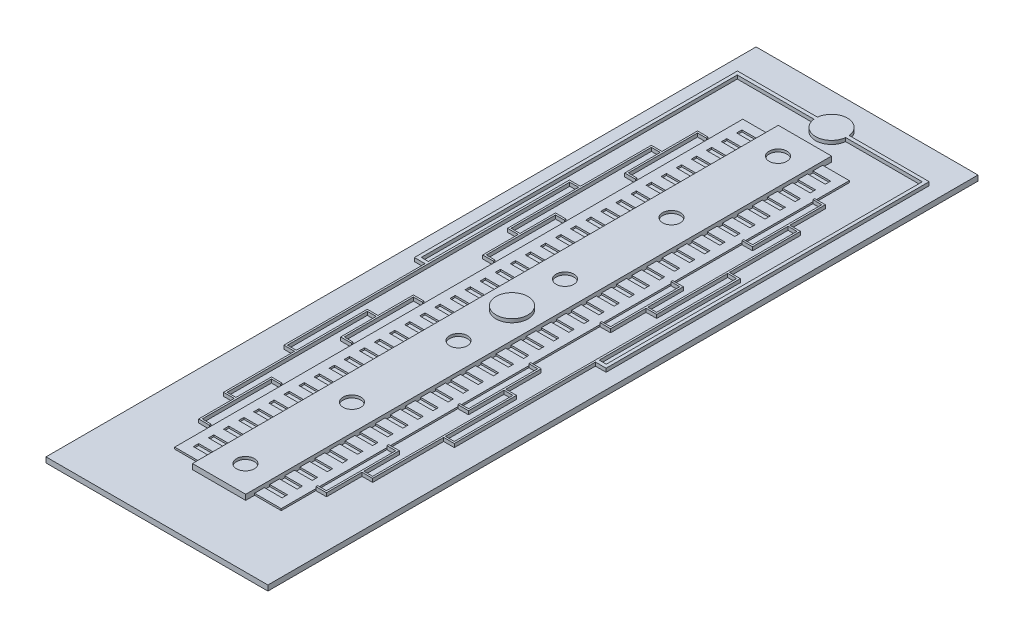
from build123d import *

# Parameters (mm, degrees)
SKETCH2_W           = 12.5
SKETCH2_H           = 40
BOSS_EXTRUDE1_DEPTH = 0.3
SKETCH3_W           = 3
SKETCH3_H           = 33
BOSS_EXTRUDE2_DEPTH = 0.3
SKETCH4_W           = 1.5
SKETCH4_H           = 32
BOSS_EXTRUDE3_DEPTH = 0.1
SKETCH5_W           = 1
SKETCH5_H           = 0.3
CUT_EXTRUDE1_DEPTH  = 0.1
BOSS_EXTRUDE4_DEPTH = 0.2
SKETCH7_R           = 0.9
BOSS_EXTRUDE5_DEPTH = 0.2
SKETCH8_R           = 0.5
CUT_EXTRUDE2_DEPTH  = 0.15


with BuildPart() as part:
    # Sketch2 → Boss-Extrude1 (new body)
    with BuildSketch(Plane(origin=(0, 0, 0), x_dir=(1, 0, 0), z_dir=(0, 1, 0))):
        Rectangle(SKETCH2_W, SKETCH2_H)
    extrude(amount=BOSS_EXTRUDE1_DEPTH)

    # Sketch3 → Boss-Extrude2 (add)
    with BuildSketch(Plane(origin=(0, 0.3, 0), x_dir=(1, 0, 0), z_dir=(0, 1, 0))):
        Rectangle(SKETCH3_W, SKETCH3_H)
    extrude(amount=BOSS_EXTRUDE2_DEPTH)

    # Sketch4 → Boss-Extrude3 (add)
    with BuildSketch(Plane(origin=(0, 0.3, 0), x_dir=(1, 0, 0), z_dir=(0, 1, 0))):
        with Locations((2.25, 0)):
            Rectangle(SKETCH4_W, SKETCH4_H)
        with Locations((-2.25, 0)):
            Rectangle(SKETCH4_W, SKETCH4_H)
    extrude(amount=BOSS_EXTRUDE3_DEPTH)

    # Sketch5 → Cut-Extrude1 (cut)
    with BuildSketch(Plane(origin=(0, 0.4, 0), x_dir=(1, 0, 0), z_dir=(0, 1, 0))):
        with Locations((2, 15.3)):
            Rectangle(SKETCH5_W, SKETCH5_H)
        with Locations((-2, 15.3)):
            Rectangle(SKETCH5_W, SKETCH5_H)
        with Locations((-2, 14.45)):
            Rectangle(SKETCH5_W, SKETCH5_H)
        with Locations((-2, 13.6)):
            Rectangle(SKETCH5_W, SKETCH5_H)
        with Locations((-2, 12.75)):
            Rectangle(SKETCH5_W, SKETCH5_H)
        with Locations((-2, 11.9)):
            Rectangle(SKETCH5_W, SKETCH5_H)
        with Locations((-2, 11.05)):
            Rectangle(SKETCH5_W, SKETCH5_H)
        with Locations((-2, 10.2)):
            Rectangle(SKETCH5_W, SKETCH5_H)
        with Locations((-2, 9.35)):
            Rectangle(SKETCH5_W, SKETCH5_H)
        with Locations((-2, 8.5)):
            Rectangle(SKETCH5_W, SKETCH5_H)
        with Locations((-2, 7.65)):
            Rectangle(SKETCH5_W, SKETCH5_H)
        with Locations((-2, 6.8)):
            Rectangle(SKETCH5_W, SKETCH5_H)
        with Locations((-2, 5.95)):
            Rectangle(SKETCH5_W, SKETCH5_H)
        with Locations((-2, 5.1)):
            Rectangle(SKETCH5_W, SKETCH5_H)
        with Locations((-2, 4.25)):
            Rectangle(SKETCH5_W, SKETCH5_H)
        with Locations((-2, 3.4)):
            Rectangle(SKETCH5_W, SKETCH5_H)
        with Locations((-2, 2.55)):
            Rectangle(SKETCH5_W, SKETCH5_H)
        with Locations((-2, 1.7)):
            Rectangle(SKETCH5_W, SKETCH5_H)
        with Locations((-2, 0.85)):
            Rectangle(SKETCH5_W, SKETCH5_H)
        with Locations((-2, 0)):
            Rectangle(SKETCH5_W, SKETCH5_H)
        with Locations((-2, -0.85)):
            Rectangle(SKETCH5_W, SKETCH5_H)
        with Locations((-2, -1.7)):
            Rectangle(SKETCH5_W, SKETCH5_H)
        with Locations((-2, -2.55)):
            Rectangle(SKETCH5_W, SKETCH5_H)
        with Locations((-2, -3.4)):
            Rectangle(SKETCH5_W, SKETCH5_H)
        with Locations((-2, -4.25)):
            Rectangle(SKETCH5_W, SKETCH5_H)
        with Locations((-2, -5.1)):
            Rectangle(SKETCH5_W, SKETCH5_H)
        with Locations((-2, -5.95)):
            Rectangle(SKETCH5_W, SKETCH5_H)
        with Locations((-2, -6.8)):
            Rectangle(SKETCH5_W, SKETCH5_H)
        with Locations((-2, -7.65)):
            Rectangle(SKETCH5_W, SKETCH5_H)
        with Locations((-2, -8.5)):
            Rectangle(SKETCH5_W, SKETCH5_H)
        with Locations((-2, -9.35)):
            Rectangle(SKETCH5_W, SKETCH5_H)
        with Locations((-2, -10.2)):
            Rectangle(SKETCH5_W, SKETCH5_H)
        with Locations((-2, -11.05)):
            Rectangle(SKETCH5_W, SKETCH5_H)
        with Locations((-2, -11.9)):
            Rectangle(SKETCH5_W, SKETCH5_H)
        with Locations((-2, -12.75)):
            Rectangle(SKETCH5_W, SKETCH5_H)
        with Locations((-2, -13.6)):
            Rectangle(SKETCH5_W, SKETCH5_H)
        with Locations((-2, -14.45)):
            Rectangle(SKETCH5_W, SKETCH5_H)
        with Locations((-2, -15.3)):
            Rectangle(SKETCH5_W, SKETCH5_H)
        with Locations((2, 14.45)):
            Rectangle(SKETCH5_W, SKETCH5_H)
        with Locations((2, 13.6)):
            Rectangle(SKETCH5_W, SKETCH5_H)
        with Locations((2, 12.75)):
            Rectangle(SKETCH5_W, SKETCH5_H)
        with Locations((2, 11.9)):
            Rectangle(SKETCH5_W, SKETCH5_H)
        with Locations((2, 11.05)):
            Rectangle(SKETCH5_W, SKETCH5_H)
        with Locations((2, 10.2)):
            Rectangle(SKETCH5_W, SKETCH5_H)
        with Locations((2, 9.35)):
            Rectangle(SKETCH5_W, SKETCH5_H)
        with Locations((2, 8.5)):
            Rectangle(SKETCH5_W, SKETCH5_H)
        with Locations((2, 7.65)):
            Rectangle(SKETCH5_W, SKETCH5_H)
        with Locations((2, 6.8)):
            Rectangle(SKETCH5_W, SKETCH5_H)
        with Locations((2, 5.95)):
            Rectangle(SKETCH5_W, SKETCH5_H)
        with Locations((2, 5.1)):
            Rectangle(SKETCH5_W, SKETCH5_H)
        with Locations((2, 4.25)):
            Rectangle(SKETCH5_W, SKETCH5_H)
        with Locations((2, 3.4)):
            Rectangle(SKETCH5_W, SKETCH5_H)
        with Locations((2, 2.55)):
            Rectangle(SKETCH5_W, SKETCH5_H)
        with Locations((2, 1.7)):
            Rectangle(SKETCH5_W, SKETCH5_H)
        with Locations((2, 0.85)):
            Rectangle(SKETCH5_W, SKETCH5_H)
        with Locations((2, 0)):
            Rectangle(SKETCH5_W, SKETCH5_H)
        with Locations((2, -0.85)):
            Rectangle(SKETCH5_W, SKETCH5_H)
        with Locations((2, -1.7)):
            Rectangle(SKETCH5_W, SKETCH5_H)
        with Locations((2, -2.55)):
            Rectangle(SKETCH5_W, SKETCH5_H)
        with Locations((2, -3.4)):
            Rectangle(SKETCH5_W, SKETCH5_H)
        with Locations((2, -4.25)):
            Rectangle(SKETCH5_W, SKETCH5_H)
        with Locations((2, -5.1)):
            Rectangle(SKETCH5_W, SKETCH5_H)
        with Locations((2, -5.95)):
            Rectangle(SKETCH5_W, SKETCH5_H)
        with Locations((2, -6.8)):
            Rectangle(SKETCH5_W, SKETCH5_H)
        with Locations((2, -7.65)):
            Rectangle(SKETCH5_W, SKETCH5_H)
        with Locations((2, -8.5)):
            Rectangle(SKETCH5_W, SKETCH5_H)
        with Locations((2, -9.35)):
            Rectangle(SKETCH5_W, SKETCH5_H)
        with Locations((2, -10.2)):
            Rectangle(SKETCH5_W, SKETCH5_H)
        with Locations((2, -11.05)):
            Rectangle(SKETCH5_W, SKETCH5_H)
        with Locations((2, -11.9)):
            Rectangle(SKETCH5_W, SKETCH5_H)
        with Locations((2, -12.75)):
            Rectangle(SKETCH5_W, SKETCH5_H)
        with Locations((2, -13.6)):
            Rectangle(SKETCH5_W, SKETCH5_H)
        with Locations((2, -14.45)):
            Rectangle(SKETCH5_W, SKETCH5_H)
        with Locations((2, -15.3)):
            Rectangle(SKETCH5_W, SKETCH5_H)
    extrude(amount=-CUT_EXTRUDE1_DEPTH, mode=Mode.SUBTRACT)

    # Sketch6 → Boss-Extrude4 (add)
    with BuildSketch(Plane(origin=(0, 0.3, 0), x_dir=(1, 0, 0), z_dir=(0, 1, 0))):
        with BuildLine():
            Line((-0.894427191, 18.1), (-5.4, 18.1))
            Line((-5.4, 18.1), (-5.4, -0.1))
            Line((-5.4, -0.1), (-4.8, -0.1))
            Line((-4.8, -0.1), (-4.799975197, -8.05))
            Line((-4.799975197, -8.05), (-4.199975197, -8.05))
            Line((-4.199975197, -8.05), (-4.2, -12.05))
            Line((-4.2, -12.05), (-3.6, -12.05))
            Line((-3.6, -12.05), (-3.6, -14.05))
            Line((-3.6, -14.05), (-3, -14.05))
            Line((-3, -14.05), (-3, -13.95))
            Line((-3, -13.95), (-3.5, -13.95))
            Line((-3.5, -13.95), (-3.5, -10.05))
            Line((-3.5, -10.05), (-3, -10.05))
            Line((-3, -10.05), (-3, -9.95))
            Line((-3, -9.95), (-3.6, -9.95))
            Line((-3.6, -9.95), (-3.6, -11.95))
            Line((-3.6, -11.95), (-4.1, -11.95))
            Line((-4.1, -11.95), (-4.099975197, -4.05))
            Line((-4.099975197, -4.05), (-3.599975197, -4.05))
            Line((-3.599975197, -4.05), (-3.6, -6.05))
            Line((-3.6, -6.05), (-3, -6.05))
            Line((-3, -6.05), (-3, -5.95))
            Line((-3, -5.95), (-3.5, -5.95))
            Line((-3.5, -5.95), (-3.499979331, -2.0545463))
            Line((-3.499979331, -2.0545463), (-3, -2.05))
            Line((-3, -2.05), (-3, -1.95))
            Line((-3, -1.95), (-3.599975197, -1.95545556))
            Line((-3.599975197, -1.95545556), (-3.599975197, -3.95))
            Line((-3.599975197, -3.95), (-4.199975197, -3.95))
            Line((-4.199975197, -3.95), (-4.199975197, -7.95))
            Line((-4.199975197, -7.95), (-4.699975197, -7.95))
            Line((-4.699975197, -7.95), (-4.7, 7.95))
            Line((-4.7, 7.95), (-4.2, 7.95))
            Line((-4.2, 7.95), (-4.2, 3.95))
            Line((-4.2, 3.95), (-3.6, 3.95))
            Line((-3.6, 3.95), (-3.6, 1.95))
            Line((-3.6, 1.95), (-3, 1.95))
            Line((-3, 1.95), (-3, 2.05))
            Line((-3, 2.05), (-3.5, 2.05))
            Line((-3.5, 2.05), (-3.5, 5.95))
            Line((-3.5, 5.95), (-3, 5.95))
            Line((-3, 5.95), (-3, 6.05))
            Line((-3, 6.05), (-3.6, 6.05))
            Line((-3.6, 6.05), (-3.6, 4.05))
            Line((-3.6, 4.05), (-4.1, 4.05))
            Line((-4.1, 4.05), (-4.1, 11.95))
            Line((-4.1, 11.95), (-3.6, 11.95))
            Line((-3.6, 11.95), (-3.6, 9.95))
            Line((-3.6, 9.95), (-3, 9.95))
            Line((-3, 9.95), (-3, 10.05))
            Line((-3, 10.05), (-3.5, 10.05))
            Line((-3.5, 10.05), (-3.5, 13.95))
            Line((-3.5, 13.95), (-3, 13.95))
            Line((-3, 13.95), (-3, 14.05))
            Line((-3, 14.05), (-3.6, 14.05))
            Line((-3.6, 14.05), (-3.6, 12.05))
            Line((-3.6, 12.05), (-4.2, 12.05))
            Line((-4.2, 12.05), (-4.2, 8.05))
            Line((-4.2, 8.05), (-4.811155033, 8.05))
            Line((-4.811155033, 8.05), (-4.811155033, 0.1))
            Line((-4.811155033, 0.1), (-5.211155033, 0.1))
            Line((-5.211155033, 0.1), (-5.211155033, 17.9))
            Line((-5.211155033, 17.9), (-0.894427191, 17.9))
            ThreePointArc((-0.894427191, 17.9), (0, 17.1), (0.894427191, 17.9))
            Line((0.894427191, 17.9), (5.211155033, 17.9))
            Line((5.211155033, 17.9), (5.211155033, 0.1))
            Line((5.211155033, 0.1), (4.811155033, 0.1))
            Line((4.811155033, 0.1), (4.811155033, 8.05))
            Line((4.811155033, 8.05), (4.2, 8.05))
            Line((4.2, 8.05), (4.2, 12.05))
            Line((4.2, 12.05), (3.6, 12.05))
            Line((3.6, 12.05), (3.6, 14.05))
            Line((3.6, 14.05), (3, 14.05))
            Line((3, 14.05), (3, 13.95))
            Line((3, 13.95), (3.5, 13.95))
            Line((3.5, 13.95), (3.5, 10.05))
            Line((3.5, 10.05), (3, 10.05))
            Line((3, 10.05), (3, 9.95))
            Line((3, 9.95), (3.6, 9.95))
            Line((3.6, 9.95), (3.6, 11.95))
            Line((3.6, 11.95), (4.1, 11.95))
            Line((4.1, 11.95), (4.1, 4.05))
            Line((4.1, 4.05), (3.6, 4.05))
            Line((3.6, 4.05), (3.6, 6.05))
            Line((3.6, 6.05), (3, 6.05))
            Line((3, 6.05), (3, 5.95))
            Line((3, 5.95), (3.5, 5.95))
            Line((3.5, 5.95), (3.5, 2.05))
            Line((3.5, 2.05), (3, 2.05))
            Line((3, 2.05), (3, 1.95))
            Line((3, 1.95), (3.6, 1.95))
            Line((3.6, 1.95), (3.6, 3.95))
            Line((3.6, 3.95), (4.2, 3.95))
            Line((4.2, 3.95), (4.2, 7.95))
            Line((4.2, 7.95), (4.7, 7.95))
            Line((4.7, 7.95), (4.699975197, -7.95))
            Line((4.699975197, -7.95), (4.199975197, -7.95))
            Line((4.199975197, -7.95), (4.199975197, -3.95))
            Line((4.199975197, -3.95), (3.599975197, -3.95))
            Line((3.599975197, -3.95), (3.599975197, -1.95545556))
            Line((3.599975197, -1.95545556), (3, -1.95))
            Line((3, -1.95), (3, -2.05))
            Line((3, -2.05), (3.499979331, -2.0545463))
            Line((3.499979331, -2.0545463), (3.5, -5.95))
            Line((3.5, -5.95), (3, -5.95))
            Line((3, -5.95), (3, -6.05))
            Line((3, -6.05), (3.6, -6.05))
            Line((3.6, -6.05), (3.599975197, -4.05))
            Line((3.599975197, -4.05), (4.099975197, -4.05))
            Line((4.099975197, -4.05), (4.1, -11.95))
            Line((4.1, -11.95), (3.6, -11.95))
            Line((3.6, -11.95), (3.6, -9.95))
            Line((3.6, -9.95), (3, -9.95))
            Line((3, -9.95), (3, -10.05))
            Line((3, -10.05), (3.5, -10.05))
            Line((3.5, -10.05), (3.5, -13.95))
            Line((3.5, -13.95), (3, -13.95))
            Line((3, -13.95), (3, -14.05))
            Line((3, -14.05), (3.6, -14.05))
            Line((3.6, -14.05), (3.6, -12.05))
            Line((3.6, -12.05), (4.2, -12.05))
            Line((4.2, -12.05), (4.199975197, -8.05))
            Line((4.199975197, -8.05), (4.799975197, -8.05))
            Line((4.799975197, -8.05), (4.8, -0.1))
            Line((4.8, -0.1), (5.4, -0.1))
            Line((5.4, -0.1), (5.4, 18.1))
            Line((5.4, 18.1), (0.894427191, 18.1))
            ThreePointArc((0.894427191, 18.1), (0, 18.9), (-0.894427191, 18.1))
        make_face()
    extrude(amount=BOSS_EXTRUDE4_DEPTH)

    # Sketch7 → Boss-Extrude5 (add)
    with BuildSketch(Plane(origin=(0, 0.6, 0), x_dir=(1, 0, 0), z_dir=(0, 1, 0))):
        Circle(SKETCH7_R)
    extrude(amount=BOSS_EXTRUDE5_DEPTH)

    # Sketch8 → Cut-Extrude2 (cut)
    with BuildSketch(Plane(origin=(0, 0.6, 0), x_dir=(1, 0, 0), z_dir=(0, 1, 0))):
        with Locations((0, 14.985179419)):
            Circle(SKETCH8_R)
        with Locations((0, 8.985179419)):
            Circle(SKETCH8_R)
        with Locations((0, 2.985179419)):
            Circle(SKETCH8_R)
        with Locations((0, -3.014820581)):
            Circle(SKETCH8_R)
        with Locations((0, -9.014820581)):
            Circle(SKETCH8_R)
        with Locations((0, -15.014820581)):
            Circle(SKETCH8_R)
    extrude(amount=-CUT_EXTRUDE2_DEPTH, mode=Mode.SUBTRACT)


solid = part.part
